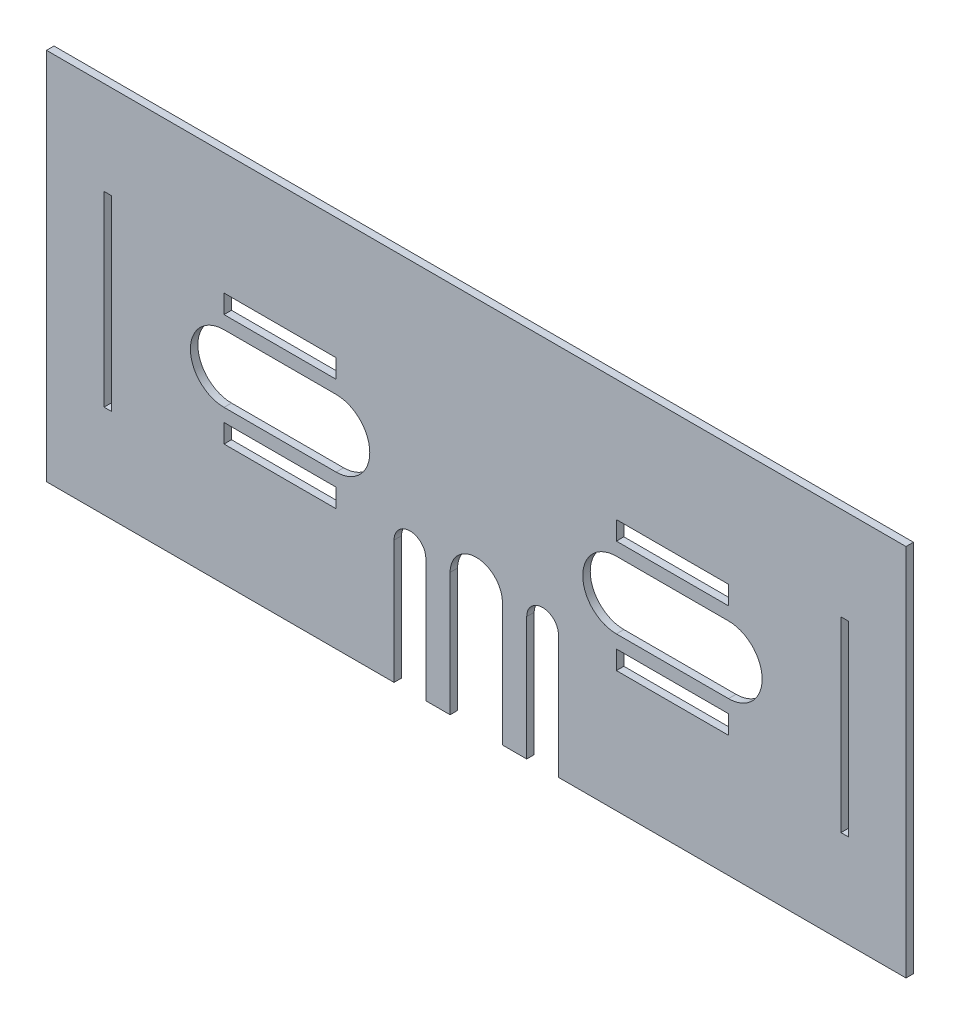
from build123d import *

# Parameters (mm, degrees)
SKETCH_1_W               = 230
SKETCH_1_H               = 100
EXTRUDE_1_DEPTH          = 2
CUT_EXTRUDE_2_DEPTH      = 2
CUT_EXTRUDE_2_DEPTH_BACK = 2
SKETCH_3_W               = 2
SKETCH_3_H               = 50
SKETCH_3_W_2             = 30
SKETCH_3_H_2             = 5
CUT_EXTRUDE_3_DEPTH      = 2
CUT_EXTRUDE_3_DEPTH_BACK = 2


with BuildPart() as part:
    # 草图1 → 凸台-拉伸1 (new body)
    with BuildSketch(Plane.XY):
        with Locations((65.955242642, -29.076013845)):
            Rectangle(SKETCH_1_W, SKETCH_1_H)
    extrude(amount=EXTRUDE_1_DEPTH)

    # 草图3 → 切除-拉伸2 (cut, two sides: drawn at the far end of the back side and taken through both)
    with BuildSketch(Plane.XY.offset(-CUT_EXTRUDE_2_DEPTH_BACK)):
        with Locations((-32.644757358, -29.076013845)):
            Rectangle(SKETCH_3_W, SKETCH_3_H)
        with Locations((13.455242642, -14.076013845)):
            Rectangle(SKETCH_3_W_2, SKETCH_3_H_2)
        with BuildLine():
            Line((-1.544757358, -20.076013845), (28.455242642, -20.076013845))
            ThreePointArc((28.455242642, -20.076013845), (37.455242642, -29.076013845), (28.455242642, -38.076013845))
            Line((28.455242642, -38.076013845), (-1.544757358, -38.076013845))
            ThreePointArc((-1.544757358, -38.076013845), (-10.544757358, -29.076013845), (-1.544757358, -20.076013845))
        make_face()
        with Locations((13.455242642, -44.076013845)):
            Rectangle(SKETCH_3_W_2, SKETCH_3_H_2)
        with Locations((118.455242642, -44.076013845)):
            Rectangle(SKETCH_3_W_2, SKETCH_3_H_2)
        with BuildLine():
            Line((133.455242642, -38.076013845), (103.455242642, -38.076013845))
            ThreePointArc((103.455242642, -38.076013845), (94.455242642, -29.076013845), (103.455242642, -20.076013845))
            Line((103.455242642, -20.076013845), (133.455242642, -20.076013845))
            ThreePointArc((133.455242642, -20.076013845), (142.455242642, -29.076013845), (133.455242642, -38.076013845))
        make_face()
        with Locations((118.455242642, -14.076013845)):
            Rectangle(SKETCH_3_W_2, SKETCH_3_H_2)
        with Locations((164.555242642, -29.076013845)):
            Rectangle(SKETCH_3_W, SKETCH_3_H)
    extrude(amount=CUT_EXTRUDE_2_DEPTH + CUT_EXTRUDE_2_DEPTH_BACK, mode=Mode.SUBTRACT)

    # 草图4 → 切除-拉伸3 (cut, two sides: drawn at the far end of the back side and taken through both)
    with BuildSketch(Plane.XY.offset(-CUT_EXTRUDE_3_DEPTH_BACK)):
        with BuildLine():
            Line((43.955242642, -46.076013845), (43.955242642, -79.076013845))
            Line((43.955242642, -79.076013845), (52.455242642, -79.076013845))
            Line((52.455242642, -79.076013845), (52.455242642, -46.076013845))
            ThreePointArc((52.455242642, -46.076013845), (48.205242642, -41.826013845), (43.955242642, -46.076013845))
        make_face()
        with BuildLine():
            Line((58.955242642, -46.076013845), (58.955242642, -79.076013845))
            Line((58.955242642, -79.076013845), (72.955242642, -79.076013845))
            Line((72.955242642, -79.076013845), (72.955242642, -46.076013845))
            ThreePointArc((72.955242642, -46.076013845), (65.955242642, -39.076013845), (58.955242642, -46.076013845))
        make_face()
        with BuildLine():
            Line((79.455242642, -46.076013845), (79.455242642, -79.076013845))
            Line((79.455242642, -79.076013845), (87.955242642, -79.076013845))
            Line((87.955242642, -79.076013845), (87.955242642, -46.076013845))
            ThreePointArc((87.955242642, -46.076013845), (83.705242642, -41.826013845), (79.455242642, -46.076013845))
        make_face()
    extrude(amount=CUT_EXTRUDE_3_DEPTH + CUT_EXTRUDE_3_DEPTH_BACK, mode=Mode.SUBTRACT)


solid = part.part
